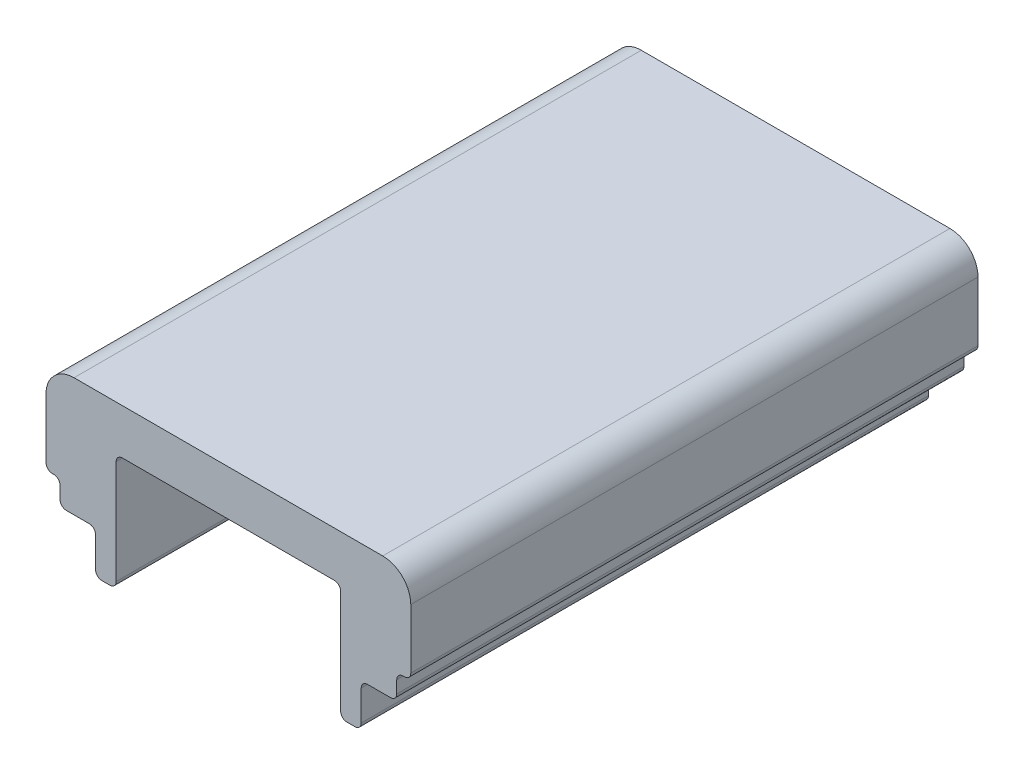
from build123d import *

# Parameters (mm, degrees)
BOSS_EXTRUDE1_DEPTH = 513.461


with BuildPart() as part:
    # Sketch1 → Boss-Extrude1 (new body)
    with BuildSketch(Plane.XY):
        with BuildLine():
            ThreePointArc((-165.1, 5.715), (-163.426115254, 1.673884746), (-159.385, 0))
            Line((-159.385, 0), (-158.115, 0))
            ThreePointArc((-158.115, 0), (-154.073884746, -1.673884746), (-152.4, -5.715))
            Line((-152.4, -5.715), (-152.4, -16.91))
            ThreePointArc((-152.4, -16.91), (-150.726115254, -20.951115254), (-146.685, -22.625))
            Line((-146.685, -22.625), (-125.96, -22.625))
            ThreePointArc((-125.96, -22.625), (-121.918884746, -24.298884746), (-120.245, -28.34))
            Line((-120.245, -28.34), (-120.245, -55.82))
            ThreePointArc((-120.245, -55.82), (-118.571115254, -59.861115254), (-114.53, -61.535))
            Line((-114.53, -61.535), (-107.315, -61.535))
            ThreePointArc((-107.315, -61.535), (-103.273884746, -59.861115254), (-101.6, -55.82))
            Line((-101.6, -55.82), (-101.6, 0))
            Line((-101.6, 0), (-101.6, 38.17350945))
            ThreePointArc((-101.6, 38.17350945), (-99.926115254, 42.214624704), (-95.885, 43.88850945))
            Line((-95.885, 43.88850945), (95.885, 43.88850945))
            ThreePointArc((95.885, 43.88850945), (99.926115254, 42.214624704), (101.6, 38.17350945))
            Line((101.6, 38.17350945), (101.6, 0))
            Line((101.6, 0), (101.6, -55.82))
            ThreePointArc((101.6, -55.82), (103.273884746, -59.861115254), (107.315, -61.535))
            Line((107.315, -61.535), (114.53, -61.535))
            ThreePointArc((114.53, -61.535), (118.571115254, -59.861115254), (120.245, -55.82))
            Line((120.245, -55.82), (120.245, -28.34))
            ThreePointArc((120.245, -28.34), (121.918884746, -24.298884746), (125.96, -22.625))
            Line((125.96, -22.625), (146.685, -22.625))
            ThreePointArc((146.685, -22.625), (150.726115254, -20.951115254), (152.4, -16.91))
            Line((152.4, -16.91), (152.4, -5.715))
            ThreePointArc((152.4, -5.715), (154.073884746, -1.673884746), (158.115, 0))
            Line((158.115, 0), (159.385, 0))
            ThreePointArc((159.385, 0), (163.426115254, 1.673884746), (165.1, 5.715))
            Line((165.1, 5.715), (165.1, 59.52))
            ThreePointArc((165.1, 59.52), (157.660512242, 77.480512242), (139.7, 84.92))
            Line((139.7, 84.92), (-139.7, 84.92))
            ThreePointArc((-139.7, 84.92), (-157.660512242, 77.480512242), (-165.1, 59.52))
            Line((-165.1, 59.52), (-165.1, 5.715))
        make_face()
    extrude(amount=BOSS_EXTRUDE1_DEPTH)


solid = part.part
